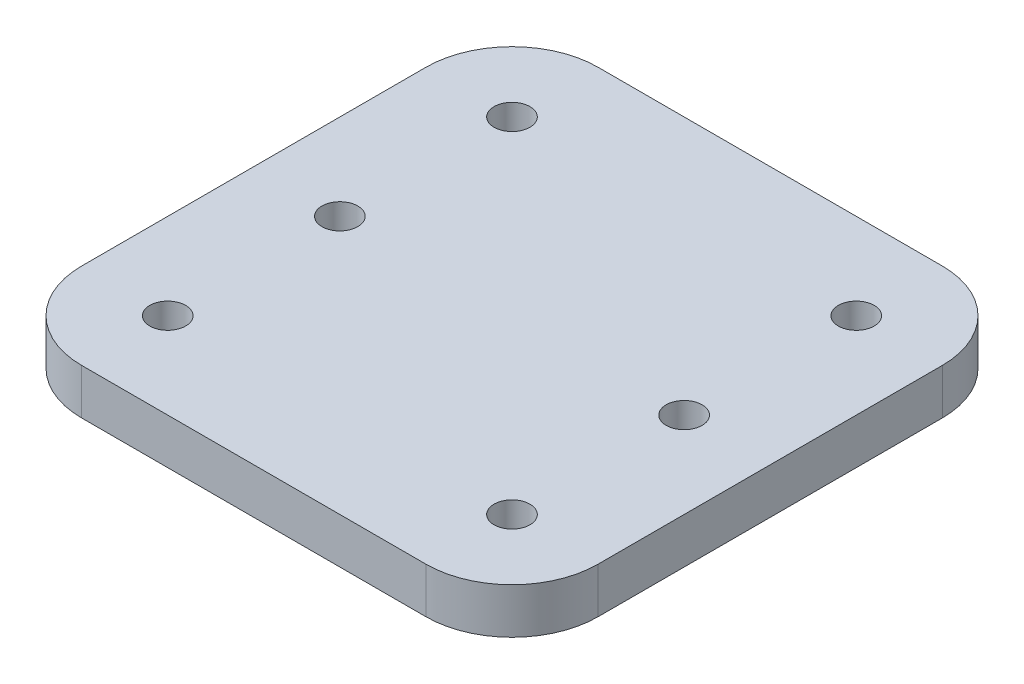
from build123d import *

# Parameters (mm, degrees)
BOSS_EXTRUDE1_DEPTH = 6.35
SKETCH2_R           = 2.5
CUT_EXTRUDE1_DEPTH  = 52.306164347
SKETCH3_R           = 2.5
CUT_EXTRUDE2_DEPTH  = 52.306164347


with BuildPart() as part:
    # Sketch1 → Boss-Extrude1 (new body)
    with BuildSketch(Plane(origin=(0, 0, 0), x_dir=(1, 0, 0), z_dir=(0, 1, 0))):
        with BuildLine():
            Line((-24, -36), (24, -36))
            ThreePointArc((24, -36), (32.485281374, -32.485281374), (36, -24))
            Line((36, -24), (36, 24))
            ThreePointArc((36, 24), (32.485281374, 32.485281374), (24, 36))
            Line((24, 36), (-24, 36))
            ThreePointArc((-24, 36), (-32.485281374, 32.485281374), (-36, 24))
            Line((-36, 24), (-36, -24))
            ThreePointArc((-36, -24), (-32.485281374, -32.485281374), (-24, -36))
        make_face()
    extrude(amount=BOSS_EXTRUDE1_DEPTH)

    # Sketch2 → Cut-Extrude1 (cut, through all)
    with BuildSketch(Plane(origin=(0, 6.35, 0), x_dir=(1, 0, 0), z_dir=(0, 1, 0))):
        with Locations((-24, 24)):
            Circle(SKETCH2_R)
        with Locations((24, 24)):
            Circle(SKETCH2_R)
        with Locations((24, -24)):
            Circle(SKETCH2_R)
        with Locations((-24, -24)):
            Circle(SKETCH2_R)
    extrude(amount=-CUT_EXTRUDE1_DEPTH, mode=Mode.SUBTRACT)

    # Sketch3 → Cut-Extrude2 (cut, through all)
    with BuildSketch(Plane(origin=(0, 6.35, 0), x_dir=(1, 0, 0), z_dir=(0, 1, 0))):
        with Locations((-24, 0)):
            Circle(SKETCH3_R)
        with Locations((24, 0)):
            Circle(SKETCH3_R)
    extrude(amount=-CUT_EXTRUDE2_DEPTH, mode=Mode.SUBTRACT)


solid = part.part
